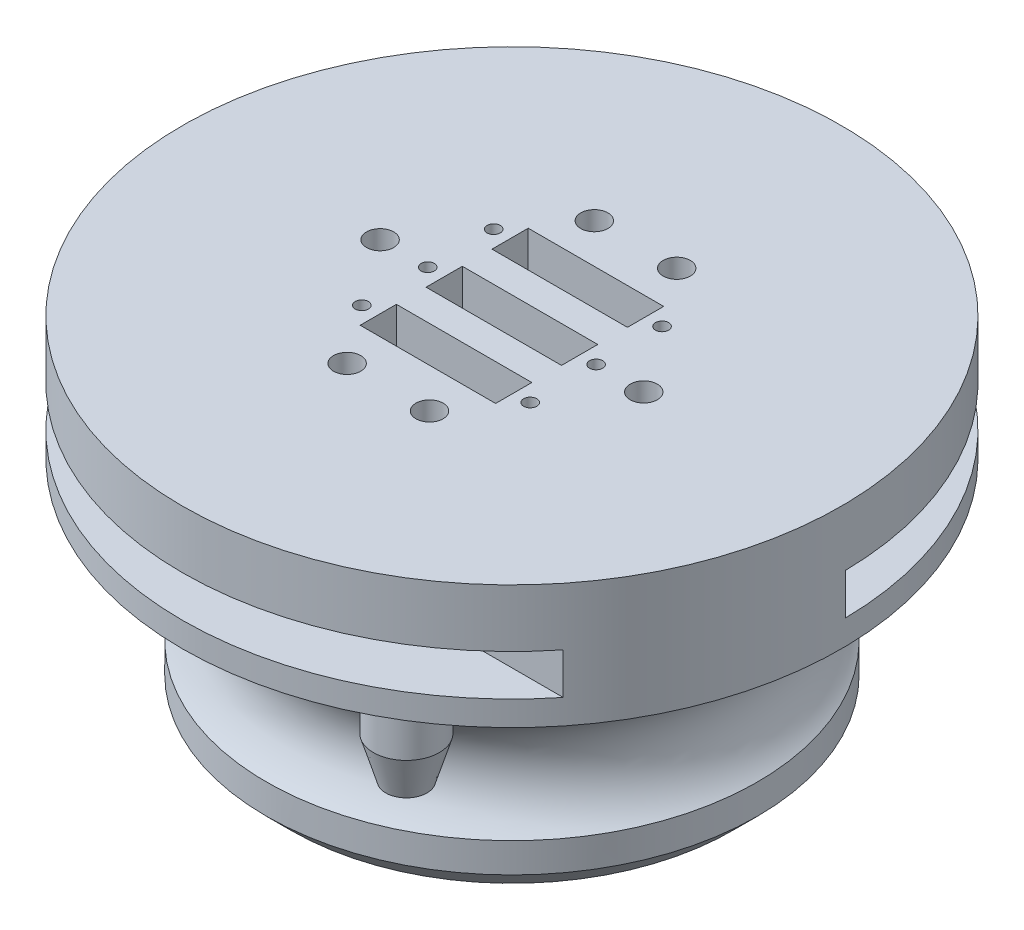
from build123d import *

# Parameters (mm, degrees)
SKETCH1_R               = 29.8
SKETCH1_R_2             = 20.2
BOSS_EXTRUDE1_DEPTH     = 25.7
SKETCH3_R               = 40
BOSS_EXTRUDE2_DEPTH     = 15
SKETCH4_R               = 4
BOSS_EXTRUDE3_DEPTH     = 5
SKETCH6_R               = 2.5
CUT_EXTRUDE1_START      = -12
CUT_EXTRUDE1_DEPTH      = 5
CUT_EXTRUDE6_DEPTH      = 3.2
SKETCH15_W              = 16.44
SKETCH15_H              = 4.4
CUT_EXTRUDE7_DEPTH      = 63.132841557
SKETCH16_R              = 0.8
CUT_EXTRUDE8_DEPTH      = 64.523302811
SKETCH17_R              = 2.75
SKETCH17_R_2            = 1.65
CUT_EXTRUDE9_DEPTH      = 5
CUT_EXTRUDE10_START     = 30.7
CUT_EXTRUDE10_OUTLINE_R = 1.65
CUT_EXTRUDE10_DEPTH     = 10
CUT_EXTRUDE11_DEPTH     = 8.5
BOSS_EXTRUDE4_DEPTH     = 3.5
BOSS_EXTRUDE4_2_DEPTH   = 3.5


with BuildPart() as part:
    # Sketch1 → Boss-Extrude1 (new body)
    with BuildSketch(Plane(origin=(0, 0, 0), x_dir=(1, 0, 0), z_dir=(0, 1, 0))):
        with Locations(Location((0, 0, 0), (0, 0, 90))):
            Circle(SKETCH1_R)
        with Locations(Location((0, 0, 0), (0, 0, 90))):
            Circle(SKETCH1_R_2, mode=Mode.SUBTRACT)
    extrude(amount=BOSS_EXTRUDE1_DEPTH)

    # Sketch2 → Cut-Revolve1 (revolve, cut)
    with BuildSketch(Plane.XY, mode=Mode.PRIVATE) as cut_revolve1_sk:
        with BuildLine():
            Line((29.8, 12.7), (29.8, 18.799180273))
            ThreePointArc((29.8, 18.799180273), (27.590586132, 16.098529094), (26.8, 12.7))
            Line((26.8, 12.7), (29.8, 12.7))
        make_face()
        with BuildLine():
            Line((29.8, 6.600819727), (29.8, 12.7))
            Line((29.8, 12.7), (26.8, 12.7))
            ThreePointArc((26.8, 12.7), (27.590586132, 9.301470906), (29.8, 6.600819727))
        make_face()
        Polygon((29.8, 3), (26.8, 0), (29.8, 0), align=None)
    revolve(cut_revolve1_sk.sketch.rotate(Axis((0, 25.7, 0), (0, -1, 0)), 270), axis=Axis((0, 25.7, 0), (0, -1, 0)), mode=Mode.SUBTRACT)

    # Sketch3 → Boss-Extrude2 (add)
    with BuildSketch(Plane(origin=(0, 25.7, 0), x_dir=(1, 0, 0), z_dir=(0, 1, 0))):
        with Locations(Location((0, 0, 0), (0, 0, 270))):
            Circle(SKETCH3_R)
    extrude(amount=BOSS_EXTRUDE2_DEPTH)

    # Sketch4 → Boss-Extrude3 (add)
    with BuildSketch(Plane(origin=(0, 25.7, 0), x_dir=(-1, 0, 0), z_dir=(0, -1, 0))):
        with Locations(Location((-17.5, -30.310889132, 0), (0, 0, 270))):
            Circle(SKETCH4_R)
        with Locations(Location((32.889241728, -11.970705016, 0), (0, 0, 270))):
            Circle(SKETCH4_R)
        with Locations(Location((-6.077686218, 34.468271355, 0), (0, 0, 270))):
            Circle(SKETCH4_R)
    extrude(amount=BOSS_EXTRUDE3_DEPTH)

    # Sketch6 → section 1 of loft1
    with BuildSketch(Plane(origin=(0, 15.7, 0), x_dir=(-1, 0, 0), z_dir=(0, -1, 0)), mode=Mode.PRIVATE) as loft1_s1:
        with Locations((32.889241728, -11.970705016)):
            Circle(SKETCH6_R)
    # loft from a face of the part (loft1)
    loft([part.faces().sort_by_distance((-32.889241728, 20.7, 11.970705016))[0], loft1_s1.sketch])

    # Boundary1: read off the stored shape, not the designer's step
    # Boundary1 outline → Boundary1 (revolve)
    with BuildSketch(Plane(origin=(17.5, 0, 30.310889132), x_dir=(1, 0, 0), z_dir=(0, 0, 1))):
        Polygon((0, 20.7), (0, 15.7), (2.5, 15.7), (4, 20.7), align=None)
    revolve(axis=Axis((17.5, 0, 30.310889132), (0, 1, 0)))

    # Boundary2: read off the stored shape, not the designer's step
    # Boundary2: loft between two sections, ruled curve by curve
    boundary2_from = [
        Edge.make_bspline([(9.922742778, 20.7, -33.365756026), (9.778423859, 20.7, -32.862439299), (9.289775651, 20.7, -31.913155977), (8.067478825, 20.7, -30.878607721), (6.542374051, 20.7, -30.390384874), (4.946413374, 20.7, -30.522974824), (3.522746317, 20.7, -31.256212676), (2.488002725, 20.7, -32.478460941), (1.999820352, 20.7, -34.003603594), (2.132382571, 20.7, -35.599531113), (2.865650923, 20.7, -37.023214684), (4.087837179, 20.7, -38.057933438), (5.613033755, 20.7, -38.546155237), (7.208931106, 20.7, -38.413575903), (8.632657493, 20.7, -37.680313497), (9.667322676, 20.7, -36.45811299), (10.155689167, 20.7, -34.933056337), (10.067061697, 20.7, -33.869072752), (9.922742778, 20.7, -33.365756026)], [0, 0, 0, 0, 0.0625, 0.125, 0.1875, 0.25, 0.3125, 0.375, 0.4375, 0.5, 0.5625, 0.625, 0.6875, 0.75, 0.8125, 0.875, 0.9375, 1, 1, 1, 1], 3),
    ]
    boundary2_to = [
        Edge.make_bspline([(8.313438837, 15.7, -33.349606871), (8.167005998, 15.7, -33.056947538), (7.757868808, 15.7, -32.529805617), (6.88811309, 15.7, -32.034506513), (5.895137902, 15.7, -31.909602819), (4.929849468, 15.7, -32.174234081), (4.139348951, 15.7, -32.788112293), (3.643935799, 15.7, -33.657748526), (3.519005287, 15.7, -34.650828768), (3.783658552, 15.7, -35.616093907), (4.397524642, 15.7, -36.406629525), (5.26722668, 15.7, -36.902042852), (6.260254151, 15.7, -37.026934051), (7.225507947, 15.7, -36.762316146), (8.016039922, 15.7, -36.14841822), (8.511411727, 15.7, -35.27881634), (8.63646584, 15.7, -34.285761617), (8.459871676, 15.7, -33.642266205), (8.313438837, 15.7, -33.349606871)], [0, 0, 0, 0, 0.0625, 0.125, 0.1875, 0.25, 0.3125, 0.375, 0.4375, 0.5, 0.5625, 0.625, 0.6875, 0.75, 0.8125, 0.875, 0.9375, 1, 1, 1, 1], 3),
    ]
    boundary2 = Solid(Shell([*[Face.make_surface_from_curves(boundary2_from[k], boundary2_to[k]) for k in range(1)], Face(Wire(boundary2_from)), Face(Wire(boundary2_to))]))
    add(boundary2)

    # Sketch7 → Cut-Extrude1 (cut)
    with BuildSketch(Plane(origin=(0, 40.7, 0), x_dir=(1, 0, 0), z_dir=(0, 1, 0)).offset(CUT_EXTRUDE1_START)):
        with BuildLine():
            ThreePointArc((31.224989992, 25), (0, 40), (-31.224989992, 25))
            Line((-31.224989992, 25), (0, 25))
            Line((0, 25), (31.224989992, 25))
        make_face()
        with BuildLine():
            Line((-5.8e-08, -25), (-31.224989992, -25))
            ThreePointArc((-31.224989992, -25), (0, -40), (31.224989992, -25))
            Line((31.224989992, -25), (-5.8e-08, -25))
        make_face()
        with BuildLine():
            Line((-19.515618745, -15.625), (-31.224989992, -25))
            Line((-31.224989992, -25), (-5.8e-08, -25))
            ThreePointArc((-5.8e-08, -25), (-10.825317574, -22.534695459), (-19.515618745, -15.625))
        make_face()
        with BuildLine():
            Line((-24.998227986, -0.297653397), (-39.997164778, -0.476245435))
            ThreePointArc((-39.997164778, -0.476245435), (-37.663011922, -13.472102025), (-31.224989992, -25))
            Line((-31.224989992, -25), (-19.515618745, -15.625))
            ThreePointArc((-19.515618745, -15.625), (-23.539382451, -8.420063766), (-24.998227986, -0.297653397))
        make_face()
        with BuildLine():
            ThreePointArc((39.997164778, 0.476245435), (37.663011922, 13.472102025), (31.224989992, 25))
            Line((31.224989992, 25), (19.515618745, 15.625))
            ThreePointArc((19.515618745, 15.625), (23.539382451, 8.420063766), (24.998227986, 0.297653397))
            Line((24.998227986, 0.297653397), (39.997164778, 0.476245435))
        make_face()
        with BuildLine():
            Line((31.224989992, 25), (0, 25))
            ThreePointArc((0, 25), (10.825317547, 22.534695472), (19.515618745, 15.625))
            Line((19.515618745, 15.625), (31.224989992, 25))
        make_face()
    extrude(amount=CUT_EXTRUDE1_DEPTH, mode=Mode.SUBTRACT)

    # Sketch14 → Cut-Extrude6 (cut)
    with BuildSketch(Plane(origin=(0, 25.7, 0), x_dir=(-1, 0, 0), z_dir=(0, -1, 0))):
        with BuildLine():
            Line((10.22, -2.2), (-10.22, -2.2))
            ThreePointArc((-10.22, -2.2), (-12.42, 0), (-10.22, 2.2))
            Line((-10.22, 2.2), (10.22, 2.2))
            ThreePointArc((10.22, 2.2), (12.42, 0), (10.22, -2.2))
        make_face()
        with BuildLine():
            Line((10.22, 10.2), (-10.22, 10.2))
            ThreePointArc((-10.22, 10.2), (-12.42, 8), (-10.22, 5.8))
            Line((-10.22, 5.8), (10.22, 5.8))
            ThreePointArc((10.22, 5.8), (12.42, 8), (10.22, 10.2))
        make_face()
        with BuildLine():
            Line((10.22, -5.8), (-10.22, -5.8))
            ThreePointArc((-10.22, -5.8), (-12.42, -8), (-10.22, -10.2))
            Line((-10.22, -10.2), (10.22, -10.2))
            ThreePointArc((10.22, -10.2), (12.42, -8), (10.22, -5.8))
        make_face()
    extrude(amount=-CUT_EXTRUDE6_DEPTH, mode=Mode.SUBTRACT)

    # Sketch15 → Cut-Extrude7 (cut, through all)
    with BuildSketch(Plane(origin=(0, 25.7, 0), x_dir=(-1, 0, 0), z_dir=(0, -1, 0))):
        Rectangle(SKETCH15_W, SKETCH15_H)
        with Locations((0, -8)):
            Rectangle(SKETCH15_W, SKETCH15_H)
        with Locations((0, 8)):
            Rectangle(SKETCH15_W, SKETCH15_H)
    extrude(amount=-CUT_EXTRUDE7_DEPTH, mode=Mode.SUBTRACT)

    # Sketch16 → Cut-Extrude8 (cut, through all)
    with BuildSketch(Plane(origin=(0, 28.9, 0), x_dir=(-1, 0, 0), z_dir=(0, -1, 0))):
        with Locations(Location((-10.22, -8, 0), (0, 0, 90))):
            Circle(SKETCH16_R)
        with Locations(Location((-10.22, 0, 0), (0, 0, 90))):
            Circle(SKETCH16_R)
        with Locations(Location((-10.22, 8, 0), (0, 0, 90))):
            Circle(SKETCH16_R)
        with Locations(Location((10.22, -8, 0), (0, 0, 90))):
            Circle(SKETCH16_R)
        with Locations(Location((10.22, 0, 0), (0, 0, 90))):
            Circle(SKETCH16_R)
        with Locations(Location((10.22, 8, 0), (0, 0, 90))):
            Circle(SKETCH16_R)
    extrude(amount=-CUT_EXTRUDE8_DEPTH, mode=Mode.SUBTRACT)

    # Sketch17 → Cut-Extrude9 (cut)
    # profile 1 of 12: a face of its own
    with BuildSketch(Plane(origin=(0, 25.7, 0), x_dir=(-1, 0, 0), z_dir=(0, -1, 0))):
        with Locations(Location((-16, 0, 0), (0, 0, 90))):
            Circle(SKETCH17_R)
        with Locations((-16, 0)):
            Circle(SKETCH17_R_2, mode=Mode.SUBTRACT)
    # profile 2 of 12: a face of its own
    with BuildSketch(Plane(origin=(0, 25.7, 0), x_dir=(-1, 0, 0), z_dir=(0, -1, 0))):
        with Locations((-16, 0)):
            Circle(SKETCH17_R_2)
    # profile 3 of 12: a face of its own
    with BuildSketch(Plane(origin=(0, 25.7, 0), x_dir=(-1, 0, 0), z_dir=(0, -1, 0))):
        with Locations(Location((-5, 15, 0), (0, 0, 90))):
            Circle(SKETCH17_R)
        with Locations((-5, 15)):
            Circle(SKETCH17_R_2, mode=Mode.SUBTRACT)
    # profile 4 of 12: a face of its own
    with BuildSketch(Plane(origin=(0, 25.7, 0), x_dir=(-1, 0, 0), z_dir=(0, -1, 0))):
        with Locations((-5, 15)):
            Circle(SKETCH17_R_2)
    # profile 5 of 12: a face of its own
    with BuildSketch(Plane(origin=(0, 25.7, 0), x_dir=(-1, 0, 0), z_dir=(0, -1, 0))):
        with Locations(Location((5, 15, 0), (0, 0, 90))):
            Circle(SKETCH17_R)
        with Locations((5, 15)):
            Circle(SKETCH17_R_2, mode=Mode.SUBTRACT)
    # profile 6 of 12: a face of its own
    with BuildSketch(Plane(origin=(0, 25.7, 0), x_dir=(-1, 0, 0), z_dir=(0, -1, 0))):
        with Locations((5, 15)):
            Circle(SKETCH17_R_2)
    # profile 7 of 12: a face of its own
    with BuildSketch(Plane(origin=(0, 25.7, 0), x_dir=(-1, 0, 0), z_dir=(0, -1, 0))):
        with Locations(Location((16, 0, 0), (0, 0, 90))):
            Circle(SKETCH17_R)
        with Locations((16, 0)):
            Circle(SKETCH17_R_2, mode=Mode.SUBTRACT)
    # profile 8 of 12: a face of its own
    with BuildSketch(Plane(origin=(0, 25.7, 0), x_dir=(-1, 0, 0), z_dir=(0, -1, 0))):
        with Locations((16, 0)):
            Circle(SKETCH17_R_2)
    # profile 9 of 12: a face of its own
    with BuildSketch(Plane(origin=(0, 25.7, 0), x_dir=(-1, 0, 0), z_dir=(0, -1, 0))):
        with Locations(Location((5, -15, 0), (0, 0, 90))):
            Circle(SKETCH17_R)
        with Locations((5, -15)):
            Circle(SKETCH17_R_2, mode=Mode.SUBTRACT)
    # profile 10 of 12: a face of its own
    with BuildSketch(Plane(origin=(0, 25.7, 0), x_dir=(-1, 0, 0), z_dir=(0, -1, 0))):
        with Locations((5, -15)):
            Circle(SKETCH17_R_2)
    # profile 11 of 12: a face of its own
    with BuildSketch(Plane(origin=(0, 25.7, 0), x_dir=(-1, 0, 0), z_dir=(0, -1, 0))):
        with Locations(Location((-5, -15, 0), (0, 0, 90))):
            Circle(SKETCH17_R)
        with Locations((-5, -15)):
            Circle(SKETCH17_R_2, mode=Mode.SUBTRACT)
    # profile 12 of 12: a face of its own
    with BuildSketch(Plane(origin=(0, 25.7, 0), x_dir=(-1, 0, 0), z_dir=(0, -1, 0))):
        with Locations((-5, -15)):
            Circle(SKETCH17_R_2)
    extrude(amount=-CUT_EXTRUDE9_DEPTH, mode=Mode.SUBTRACT)

    # Cut-Extrude10: read off the stored shape, not the designer's step
    # Cut-Extrude10 outline → Cut-Extrude10 (cut)
    with BuildSketch(Plane(origin=(0, 0, 0), x_dir=(1, 0, 0), z_dir=(0, 1, 0)).offset(CUT_EXTRUDE10_START)):
        with Locations((16, 0)):
            Circle(CUT_EXTRUDE10_OUTLINE_R)
        with Locations((5, -15)):
            Circle(CUT_EXTRUDE10_OUTLINE_R)
        with Locations((-5, -15)):
            Circle(CUT_EXTRUDE10_OUTLINE_R)
        with Locations((-16, 0)):
            Circle(CUT_EXTRUDE10_OUTLINE_R)
        with Locations((-5, 15)):
            Circle(CUT_EXTRUDE10_OUTLINE_R)
        with Locations((5, 15)):
            Circle(CUT_EXTRUDE10_OUTLINE_R)
    extrude(amount=CUT_EXTRUDE10_DEPTH, mode=Mode.SUBTRACT)

    # Sketch18 → Cut-Extrude11 (cut)
    with BuildSketch(Plane.XZ.offset(-25.7)):
        Polygon((-37.696941306, -9.542830615), (-34.387626292, -8.403342074), (-32.271433288, -14.549212815), (-35.580748302, -15.688701356), align=None)
    extrude(amount=-CUT_EXTRUDE11_DEPTH, mode=Mode.SUBTRACT)


with BuildPart() as body_2:
    # Sketch19 → Boss-Extrude4 (new body)
    with BuildSketch(Plane(origin=(-33.32952979, 0, -11.476277445), x_dir=(-0.32556815445715764, 0, 0.9455185755993165), z_dir=(-0.9455185755993165, 0, -0.32556815445715764))):
        with BuildLine():
            ThreePointArc((0, 34.2), (2.298097039, 33.248097039), (3.25, 30.95))
            Line((3.25, 30.95), (3.25, 34.2))
            Line((3.25, 34.2), (0, 34.2))
        make_face()
    extrude(amount=BOSS_EXTRUDE4_DEPTH)


with BuildPart() as body_3:
    # Sketch19 → Boss-Extrude4 2 (new body)
    with BuildSketch(Plane(origin=(-33.32952979, 0, -11.476277445), x_dir=(-0.32556815445715764, 0, 0.9455185755993165), z_dir=(-0.9455185755993165, 0, -0.32556815445715764))):
        with BuildLine():
            ThreePointArc((-3.25, 30.95), (-2.298097039, 33.248097039), (0, 34.2))
            Line((0, 34.2), (-3.25, 34.2))
            Line((-3.25, 34.2), (-3.25, 30.95))
        make_face()
    extrude(amount=BOSS_EXTRUDE4_2_DEPTH)


solid = Compound([part.part, body_2.part, body_3.part])
